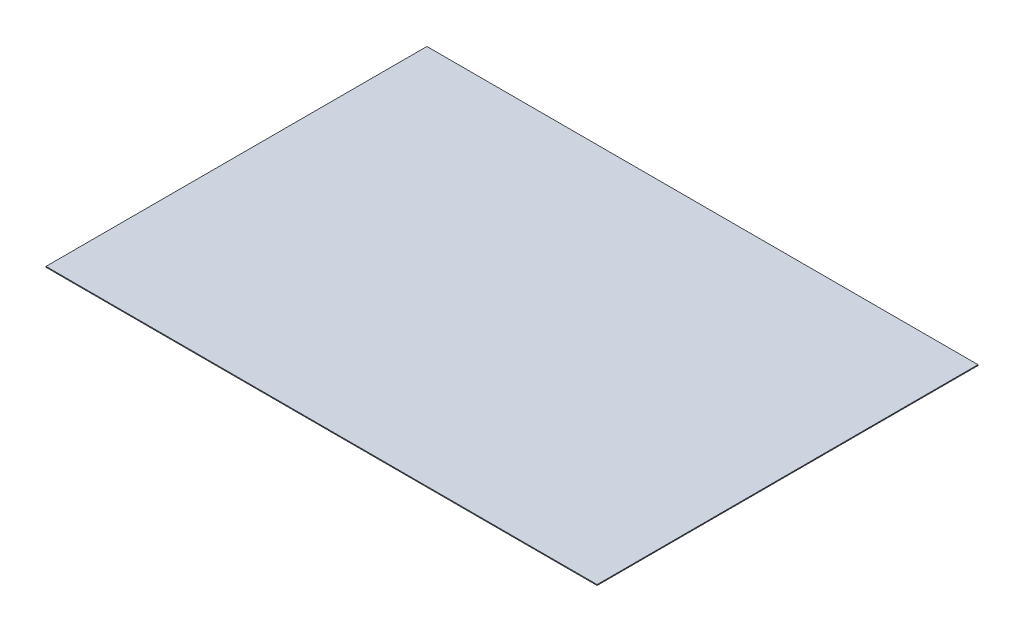
from build123d import *

# Parameters (mm, degrees)
SKETCH1_W          = 12950
SKETCH1_H          = 8950
BASE_FLANGE1_DEPTH = 20


# Sheet-metal steps are written as plain solids
with BuildPart() as part:
    # Sketch1 → Base-Flange1 (new body)
    with BuildSketch(Plane(origin=(0, 0, 0), x_dir=(1, 0, 0), z_dir=(0, 1, 0))):
        Rectangle(SKETCH1_W, SKETCH1_H)
    extrude(amount=BASE_FLANGE1_DEPTH)


solid = part.part
